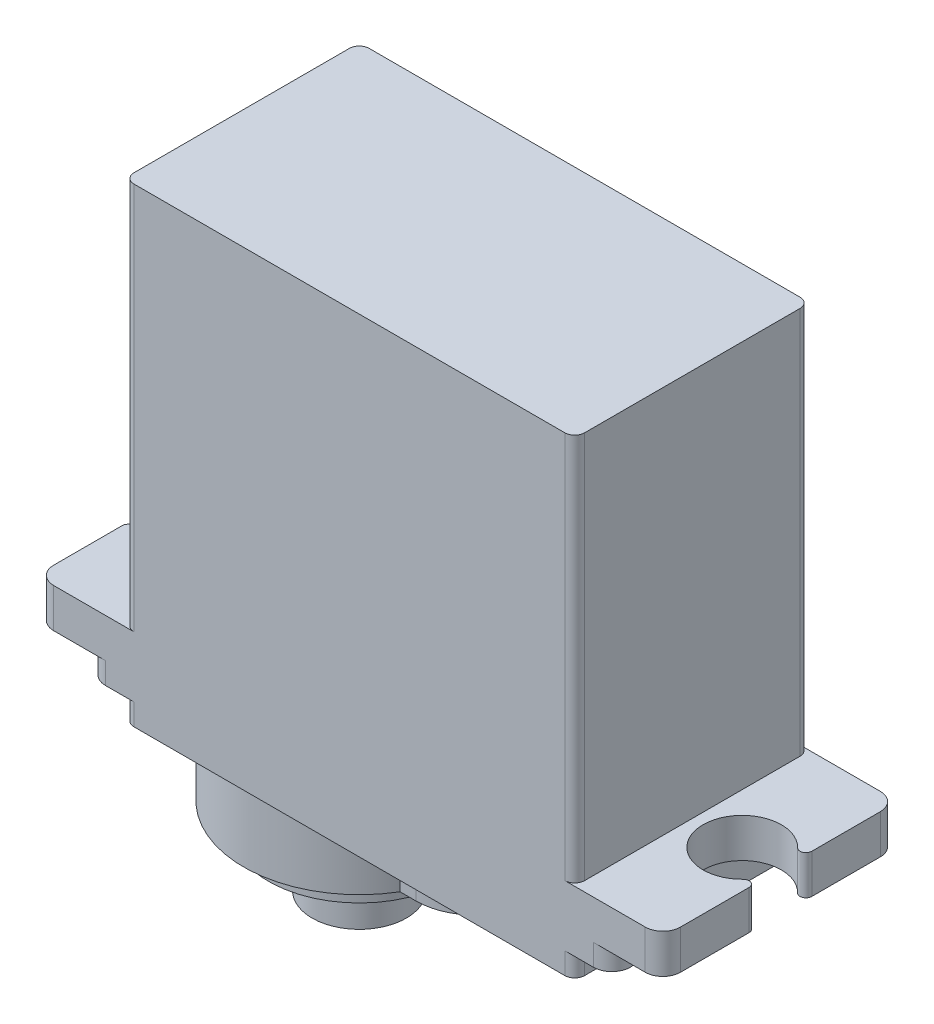
from build123d import *

# Parameters (mm, degrees)
BOSS_EXTRUDE3_DEPTH = 1.1
BOSS_EXTRUDE4_DEPTH = 24
BOSS_EXTRUDE5_DEPTH = 5.7
BOSS_EXTRUDE6_DEPTH = 6.95
SKETCH8_R           = 2.41
BOSS_EXTRUDE7_DEPTH = 9.7
BOSS_EXTRUDE8_DEPTH = 2


# Read off the part's stored shape, not the designer's step: Imported1
with BuildPart() as part:
    # Sketch4 → Boss-Extrude3 (new body)
    with BuildSketch(Plane(origin=(0, 11.6, 0), x_dir=(1, 0, 0), z_dir=(0, 1, 0))):
        with BuildLine():
            Line((-32.298673735, 38.799155683), (-7.398673735, 38.799155683))
            ThreePointArc((-7.398673735, 38.799155683), (-6.448673735, 37.849155683), (-7.398673735, 36.899155683))
            Line((-7.398673735, 36.899155683), (-8.348673735, 36.899155683))
            Line((-8.348673735, 36.899155683), (-8.348673735, 28.699155683))
            Line((-8.348673735, 28.699155683), (-7.398673735, 28.699155683))
            ThreePointArc((-7.398673735, 28.699155683), (-6.448673735, 27.749155683), (-7.398673735, 26.799155683))
            Line((-7.398673735, 26.799155683), (-32.298673735, 26.799155683))
            ThreePointArc((-32.298673735, 26.799155683), (-33.248673735, 27.749155683), (-32.298673735, 28.699155683))
            Line((-32.298673735, 28.699155683), (-31.348673735, 28.699155683))
            Line((-31.348673735, 28.699155683), (-31.348673735, 36.899155683))
            Line((-31.348673735, 36.899155683), (-32.298673735, 36.899155683))
            ThreePointArc((-32.298673735, 36.899155683), (-33.248673735, 37.849155683), (-32.298673735, 38.799155683))
        make_face()
    extrude(amount=BOSS_EXTRUDE3_DEPTH)

    # Sketch5 → Boss-Extrude4 (add)
    with BuildSketch(Plane(origin=(0, 10.5, 0), x_dir=(1, 0, 0), z_dir=(0, 1, 0))):
        with BuildLine():
            Line((-31.348673735, 27.299155683), (-31.348673735, 38.299155683))
            ThreePointArc((-31.348673735, 38.299155683), (-31.202227125, 38.652709074), (-30.848673735, 38.799155683))
            Line((-30.848673735, 38.799155683), (-8.848673735, 38.799155683))
            ThreePointArc((-8.848673735, 38.799155683), (-8.495120344, 38.652709074), (-8.348673735, 38.299155683))
            Line((-8.348673735, 38.299155683), (-8.348673735, 27.299155683))
            ThreePointArc((-8.348673735, 27.299155683), (-8.495120344, 26.945602293), (-8.848673735, 26.799155683))
            Line((-8.848673735, 26.799155683), (-30.848673735, 26.799155683))
            ThreePointArc((-30.848673735, 26.799155683), (-31.202227125, 26.945602293), (-31.348673735, 27.299155683))
        make_face()
    extrude(amount=BOSS_EXTRUDE4_DEPTH)

    # Sketch6 → Boss-Extrude5 (add)
    with BuildSketch(Plane(origin=(0, 7, 0), x_dir=(1, 0, 0), z_dir=(0, 1, 0))):
        with BuildLine():
            Line((-19.448673735, 29.799155683), (-20.268319416, 29.799155683))
            ThreePointArc((-20.268319416, 29.799155683), (-31.248673735, 32.799155683), (-20.268319416, 35.799155683))
            Line((-20.268319416, 35.799155683), (-19.448673735, 35.799155683))
            ThreePointArc((-19.448673735, 35.799155683), (-16.448673735, 32.799155683), (-19.448673735, 29.799155683))
        make_face()
    extrude(amount=BOSS_EXTRUDE5_DEPTH)

    # Sketch7 → Boss-Extrude6 (add)
    with BuildSketch(Plane(origin=(0, 5.75, 0), x_dir=(1, 0, 0), z_dir=(0, 1, 0))):
        with BuildLine():
            Line((-19.448673735, 34.049155683), (-20.869834599, 34.049155683))
            ThreePointArc((-20.869834599, 34.049155683), (-29.998673735, 32.799155683), (-20.869834599, 31.549155683))
            Line((-20.869834599, 31.549155683), (-19.448673735, 31.549155683))
            ThreePointArc((-19.448673735, 31.549155683), (-18.198673735, 32.799155683), (-19.448673735, 34.049155683))
        make_face()
    extrude(amount=BOSS_EXTRUDE6_DEPTH)

    # Sketch8 → Boss-Extrude7 (add)
    with BuildSketch(Plane(origin=(0, 3, 0), x_dir=(1, 0, 0), z_dir=(0, 1, 0))):
        with Locations(Location((-25.348673735, 32.799155683, 0), (0, 0, 270))):
            Circle(SKETCH8_R)
    extrude(amount=BOSS_EXTRUDE7_DEPTH)

    # Sketch1 → Boss-Extrude8 (add)
    with BuildSketch(Plane(origin=(0, 12.7, 0), x_dir=(1, 0, 0), z_dir=(0, 1, 0))):
        with BuildLine():
            Line((-34.948673735, 38.799155683), (-4.748673735, 38.799155683))
            ThreePointArc((-4.748673735, 38.799155683), (-4.112277632, 38.535551786), (-3.848673735, 37.899155683))
            Line((-3.848673735, 37.899155683), (-3.848673735, 34.401497719))
            ThreePointArc((-3.848673735, 34.401497719), (-4.035902323, 34.123500221), (-4.363891126, 34.192496584))
            ThreePointArc((-4.363891126, 34.192496584), (-7.798673735, 32.799155683), (-4.363891126, 31.405814782))
            ThreePointArc((-4.363891126, 31.405814782), (-4.035902323, 31.474811145), (-3.848673735, 31.196813647))
            Line((-3.848673735, 31.196813647), (-3.848673735, 27.699155683))
            ThreePointArc((-3.848673735, 27.699155683), (-4.112277632, 27.06275958), (-4.748673735, 26.799155683))
            Line((-4.748673735, 26.799155683), (-34.948673735, 26.799155683))
            ThreePointArc((-34.948673735, 26.799155683), (-35.585069838, 27.06275958), (-35.848673735, 27.699155683))
            Line((-35.848673735, 27.699155683), (-35.848673735, 31.196813647))
            ThreePointArc((-35.848673735, 31.196813647), (-35.661445146, 31.474811145), (-35.333456343, 31.405814782))
            ThreePointArc((-35.333456343, 31.405814782), (-31.898673735, 32.799155683), (-35.333456343, 34.192496584))
            ThreePointArc((-35.333456343, 34.192496584), (-35.661445146, 34.123500221), (-35.848673735, 34.401497719))
            Line((-35.848673735, 34.401497719), (-35.848673735, 37.899155683))
            ThreePointArc((-35.848673735, 37.899155683), (-35.585069838, 38.535551786), (-34.948673735, 38.799155683))
        make_face()
    extrude(amount=BOSS_EXTRUDE8_DEPTH)


solid = part.part
